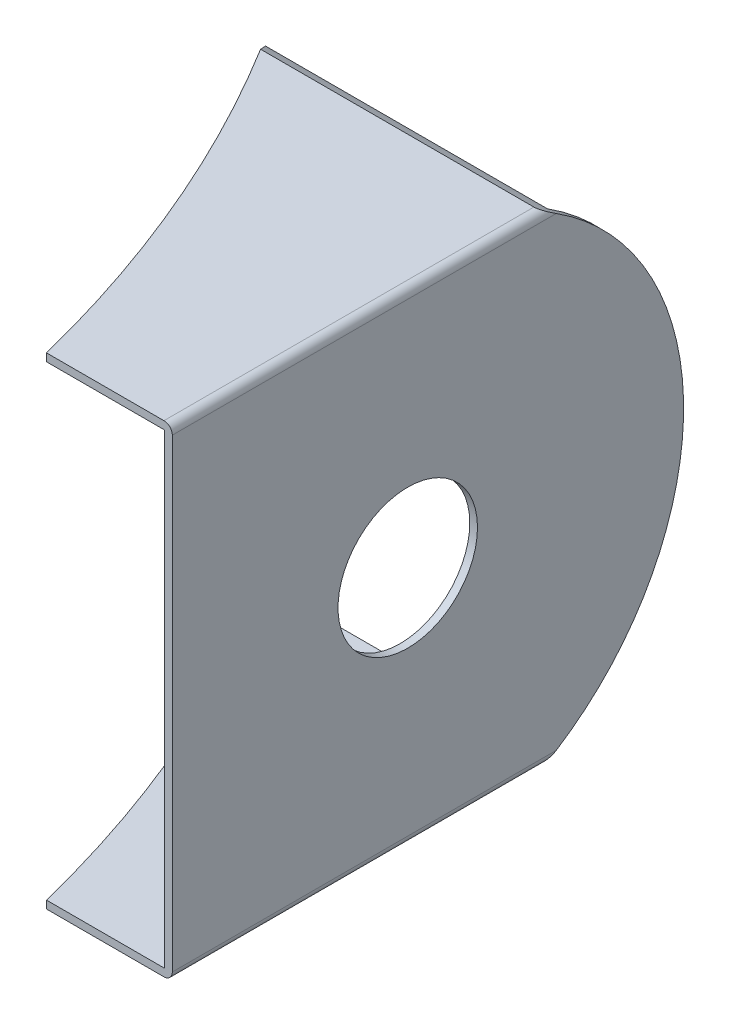
from build123d import *

# Parameters (mm, degrees)
SKETCH1_W               = 730
SKETCH1_H               = 150
BASE_FLANGE1_DEPTH      = 2.5
EDGE_FLANGE1_DEPTH      = 730
EDGE_FLANGE1_BEND_DEPTH = 730
CUT_EXTRUDE1_DEPTH      = 418.461567093
CUT_EXTRUDE1_DEPTH_BACK = 418.461567093
SKETCH12_R              = 434
SKETCH13_R              = 22.5
CUT_EXTRUDE2_DEPTH      = 10
CUT_EXTRUDE3_DEPTH      = 396.173746598
CUT_EXTRUDE3_DEPTH_BACK = 396.173746598
SKETCH14_W              = 631.337566112
SKETCH14_H              = 273.157514278
CUT_EXTRUDE4_DEPTH      = 396.173746598
CUT_EXTRUDE4_DEPTH_BACK = 396.173746598
CUT_EXTRUDE5_DEPTH      = 400.448552929


# Sheet-metal steps are written as plain solids
with BuildPart() as part:
    # Sketch1 → Base-Flange1 (new body)
    with BuildSketch(Plane(origin=(0, 0, 0), x_dir=(0, 0, -1), z_dir=(1, 0, 0))):
        Rectangle(SKETCH1_W, SKETCH1_H)
    extrude(amount=-BASE_FLANGE1_DEPTH)

    # Edge-Flange1 section (across the edge) → Edge-Flange1 (add)
    with BuildSketch(Plane(origin=(-2.5, 75.2, 365), x_dir=(0, -1, 0), z_dir=(0, 0, -1))):
        with BuildLine():
            Line((-2.5, 0.2), (-2.5, 127.5))
            Line((-2.5, 127.5), (0, 127.5))
            Line((0, 127.5), (0, 0.2))
            ThreePointArc((0, 0.2), (0.058578644, 0.058578644), (0.2, 0))
            Line((0.2, 0), (0.2, -2.5))
            ThreePointArc((0.2, -2.5), (-1.709188309, -1.709188309), (-2.5, 0.2))
        make_face()
    extrude(amount=EDGE_FLANGE1_DEPTH)

    # Edge-Flange1 section 2 (across the edge) → Edge-Flange1 bend (add)
    with BuildSketch(Plane(origin=(-2.5, -75.2, -365), x_dir=(0, 1, 0), z_dir=(0, 0, 1))):
        with BuildLine():
            Line((-2.5, 0.2), (-2.5, 127.5))
            Line((-2.5, 127.5), (0, 127.5))
            Line((0, 127.5), (0, 0.2))
            ThreePointArc((0, 0.2), (0.058578644, 0.058578644), (0.2, 0))
            Line((0.2, 0), (0.2, -2.5))
            ThreePointArc((0.2, -2.5), (-1.709188309, -1.709188309), (-2.5, 0.2))
        make_face()
    extrude(amount=EDGE_FLANGE1_BEND_DEPTH)

    # Sketch12 → Cut-Extrude1 (cut, two sides: drawn at the far end of the back side and taken through both)
    with BuildSketch(Plane(origin=(0, 77.7, 0), x_dir=(1, 0, 0), z_dir=(0, 1, 0)).offset(-CUT_EXTRUDE1_DEPTH_BACK)):
        with Locations((-470, 85)):
            Circle(SKETCH12_R)
    extrude(amount=CUT_EXTRUDE1_DEPTH + CUT_EXTRUDE1_DEPTH_BACK, mode=Mode.SUBTRACT)

    # Sketch13 → Cut-Extrude2 (cut)
    with BuildSketch(Plane(origin=(0, 0, 0), x_dir=(0, 0, -1), z_dir=(1, 0, 0))):
        with Locations((265, 0)):
            Circle(SKETCH13_R)
        with Locations((-290, 0)):
            Circle(SKETCH13_R)
    extrude(amount=-CUT_EXTRUDE2_DEPTH, mode=Mode.SUBTRACT)

    # Sketch14 → Cut-Extrude3 (cut, two sides: drawn at the far end of the back side and taken through both)
    with BuildSketch(Plane(origin=(0, 0, 0), x_dir=(0, 0, -1), z_dir=(1, 0, 0)).offset(-CUT_EXTRUDE3_DEPTH_BACK)):
        with Locations((-126.629311255, -14.019673746)):
            Rectangle(SKETCH14_W, SKETCH14_H)
    extrude(amount=CUT_EXTRUDE3_DEPTH + CUT_EXTRUDE3_DEPTH_BACK, mode=Mode.SUBTRACT)

    # Sketch15 → Cut-Extrude4 (cut, two sides: drawn at the far end of the back side and taken through both)
    with BuildSketch(Plane(origin=(0, 0, 0), x_dir=(0, 0, -1), z_dir=(1, 0, 0)).offset(-CUT_EXTRUDE4_DEPTH_BACK)):
        with BuildLine():
            Line((302.266550641, 80.822052704), (310.532003477, 105.351783703))
            Line((310.532003477, 105.351783703), (400.668447303, 94.566226322))
            Line((400.668447303, 94.566226322), (380.252927975, -108.048173048))
            Line((380.252927975, -108.048173048), (291.286888445, -85.029403714))
            ThreePointArc((291.286888445, -85.029403714), (353.805609642, -5.879089735), (302.266550641, 80.822052704))
        make_face()
    extrude(amount=CUT_EXTRUDE4_DEPTH + CUT_EXTRUDE4_DEPTH_BACK, mode=Mode.SUBTRACT)

    # Sketch16 → Cut-Extrude5 (cut, through all)
    with BuildSketch(Plane.XZ.offset(77.7)):
        with BuildLine():
            Line((-39.289490613, -183.753349909), (-75.528167694, -178.562999568))
            Line((-75.528167694, -178.562999568), (-125.004878412, -316.53047916))
            Line((-125.004878412, -316.53047916), (-101.585534734, -324.928922734))
            ThreePointArc((-101.585534734, -324.928922734), (-63.999675541, -257.181937871), (-39.289490613, -183.753349909))
        make_face()
    extrude(amount=-CUT_EXTRUDE5_DEPTH, mode=Mode.SUBTRACT)


solid = part.part
